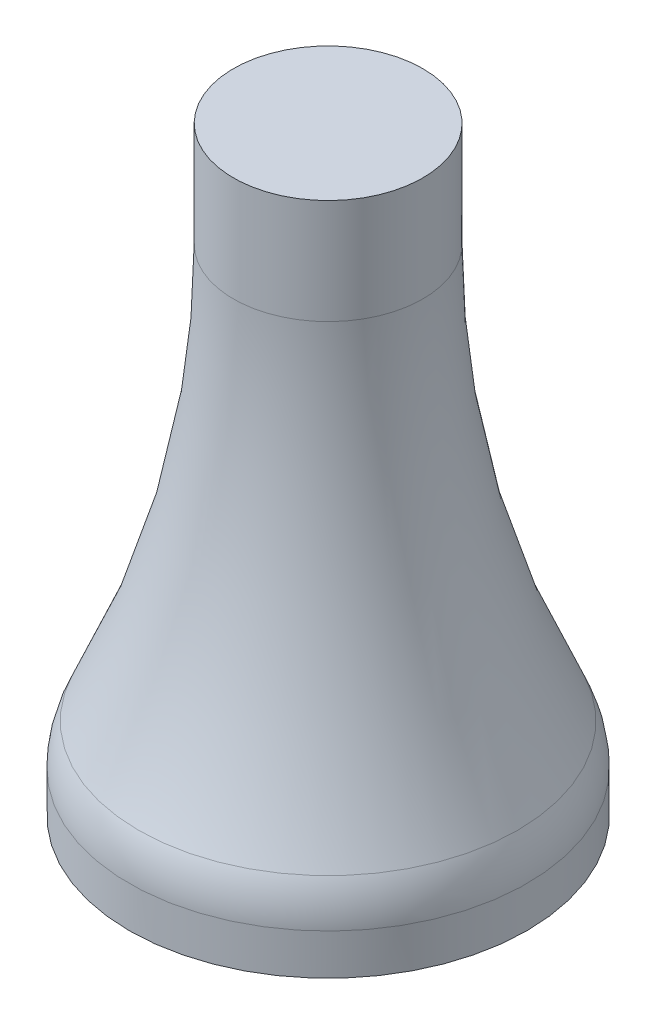
from build123d import *

# Parameters (mm, degrees)
SKETCH_1_R      = 31.5
EXTRUDE_1_DEPTH = 10
FILLET_1_R      = 150
FILLET_3_R      = 15


with BuildPart() as part:
    # 草图1 → 凸台-拉伸1 (new body)
    with BuildSketch(Plane(origin=(0, 0, 0), x_dir=(1, 0, 0), z_dir=(0, 1, 0))):
        with Locations(Location((0, 0, 0), (0, 0, 270))):
            Circle(SKETCH_1_R)
    extrude(amount=EXTRUDE_1_DEPTH)

    # 草图3 → 旋转1 (revolve)
    with BuildSketch(Plane.XY, mode=Mode.PRIVATE) as revolve_1_sk:
        Polygon((0, 95), (15, 95), (15, 25), (31.5, 10), (0, 10), align=None)
    revolve(revolve_1_sk.sketch.rotate(Axis((0, 0, 0), (0, 1, 0)), 90), axis=Axis((0, 0, 0), (0, 1, 0)))

    # 圆角1
    # the kernel refuses this fillet: 150 mm, written as the material it adds along each edge
    with BuildSketch(Plane(origin=(0, 25, 0), x_dir=(0, 0, -1), z_dir=(1, 0, 0))) as fillet_1_piece_1:
        with BuildLine():
            CenterArc((165, 53.394078691), FILLET_1_R, 180, 27.126753117)
            Line((15, 53.394078691), (12, 53.394078691))
            Line((12, 53.394078691), (12, 0))
            Line((12, 0), (12.981981618, -2.21982022))
            ThreePointArc((12.981981618, -2.21982022), (21.231981618, -9.71982022), (28.83, -16.367881574))
            Line((28.83, -16.367881574), (31.5, -15))
        make_face()
    revolve(axis=Axis((0, 25, 0), (0, 1, 0)))

    # 圆角3
    fillet_3_edges = [part.edges().sort_by_distance(p)[0] for p in [
        (-31.5, 10, 0),
    ]]
    fillet(fillet_3_edges, radius=FILLET_3_R)


solid = part.part
